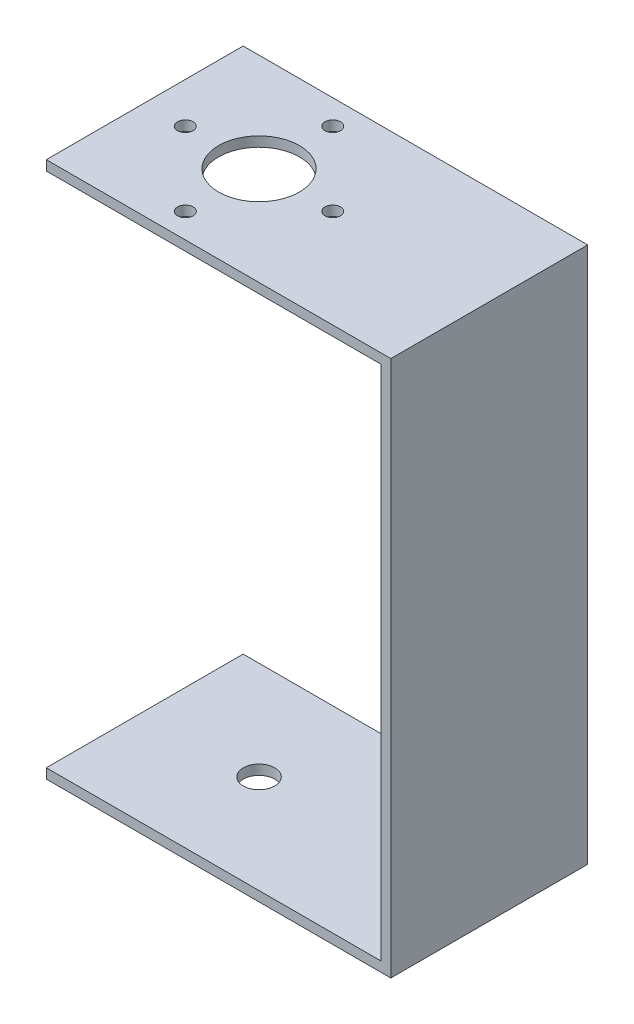
from build123d import *

# Parameters (mm, degrees)
SKETCH_1_W          = 20
SKETCH_1_H          = 54.5
EXTRUDE_1_DEPTH     = 1
SKETCH_2_W          = 20
SKETCH_2_H          = 1
EXTRUDE_2_DEPTH     = 34
SKETCH_3_W          = 20
SKETCH_3_H          = 1
EXTRUDE_3_DEPTH     = 34
SKETCH_4_R          = 4.1
CUT_EXTRUDE_1_DEPTH = 1
SKETCH_5_R          = 0.79
CUT_EXTRUDE_2_DEPTH = 1
SKETCH_6_R          = 0.79
CUT_EXTRUDE_3_DEPTH = 1
SKETCH_7_R          = 0.79
CUT_EXTRUDE_4_DEPTH = 1
SKETCH_8_R          = 0.79
CUT_EXTRUDE_5_DEPTH = 1
SKETCH_9_R          = 1.6
CUT_EXTRUDE_6_DEPTH = 1


with BuildPart() as part:
    # ｽｹｯﾁ1 → ﾎﾞｽ - 押し出し1 (new body)
    with BuildSketch(Plane(origin=(0, 0, 0), x_dir=(0, 0, -1), z_dir=(1, 0, 0))):
        with Locations((10, 27.25)):
            Rectangle(SKETCH_1_W, SKETCH_1_H)
    extrude(amount=EXTRUDE_1_DEPTH)

    # ｽｹｯﾁ2 → ﾎﾞｽ - 押し出し2 (add)
    with BuildSketch(Plane.ZY):
        with Locations((-10, 54)):
            Rectangle(SKETCH_2_W, SKETCH_2_H)
    extrude(amount=EXTRUDE_2_DEPTH)

    # ｽｹｯﾁ3 → ﾎﾞｽ - 押し出し3 (add)
    with BuildSketch(Plane.ZY):
        with Locations((-10, 0.5)):
            Rectangle(SKETCH_3_W, SKETCH_3_H)
    extrude(amount=EXTRUDE_3_DEPTH)

    # ｽｹｯﾁ4 → ｶｯﾄ - 押し出し1 (cut)
    with BuildSketch(Plane(origin=(0, 54.5, 0), x_dir=(1, 0, 0), z_dir=(0, 1, 0))):
        with Locations((-22.39, 10)):
            Circle(SKETCH_4_R)
    extrude(amount=-CUT_EXTRUDE_1_DEPTH, mode=Mode.SUBTRACT)

    # ｽｹｯﾁ5 → ｶｯﾄ - 押し出し2 (cut)
    with BuildSketch(Plane(origin=(0, 54.5, 0), x_dir=(1, 0, 0), z_dir=(0, 1, 0))):
        with Locations((-29.88, 10)):
            Circle(SKETCH_5_R)
    extrude(amount=-CUT_EXTRUDE_2_DEPTH, mode=Mode.SUBTRACT)

    # ｽｹｯﾁ6 → ｶｯﾄ - 押し出し3 (cut)
    with BuildSketch(Plane(origin=(0, 54.5, 0), x_dir=(1, 0, 0), z_dir=(0, 1, 0))):
        with Locations((-14.9, 10)):
            Circle(SKETCH_6_R)
    extrude(amount=-CUT_EXTRUDE_3_DEPTH, mode=Mode.SUBTRACT)

    # ｽｹｯﾁ7 → ｶｯﾄ - 押し出し4 (cut)
    with BuildSketch(Plane(origin=(0, 54.5, 0), x_dir=(1, 0, 0), z_dir=(0, 1, 0))):
        with Locations((-22.39, 2.51)):
            Circle(SKETCH_7_R)
    extrude(amount=-CUT_EXTRUDE_4_DEPTH, mode=Mode.SUBTRACT)

    # ｽｹｯﾁ8 → ｶｯﾄ - 押し出し5 (cut)
    with BuildSketch(Plane(origin=(0, 54.5, 0), x_dir=(1, 0, 0), z_dir=(0, 1, 0))):
        with Locations((-22.39, 17.49)):
            Circle(SKETCH_8_R)
    extrude(amount=-CUT_EXTRUDE_5_DEPTH, mode=Mode.SUBTRACT)

    # ｽｹｯﾁ9 → ｶｯﾄ - 押し出し6 (cut)
    with BuildSketch(Plane(origin=(0, 0, 0), x_dir=(-1, 0, 0), z_dir=(0, -1, 0))):
        with Locations((22.39, 10)):
            Circle(SKETCH_9_R)
    extrude(amount=-CUT_EXTRUDE_6_DEPTH, mode=Mode.SUBTRACT)


solid = part.part
